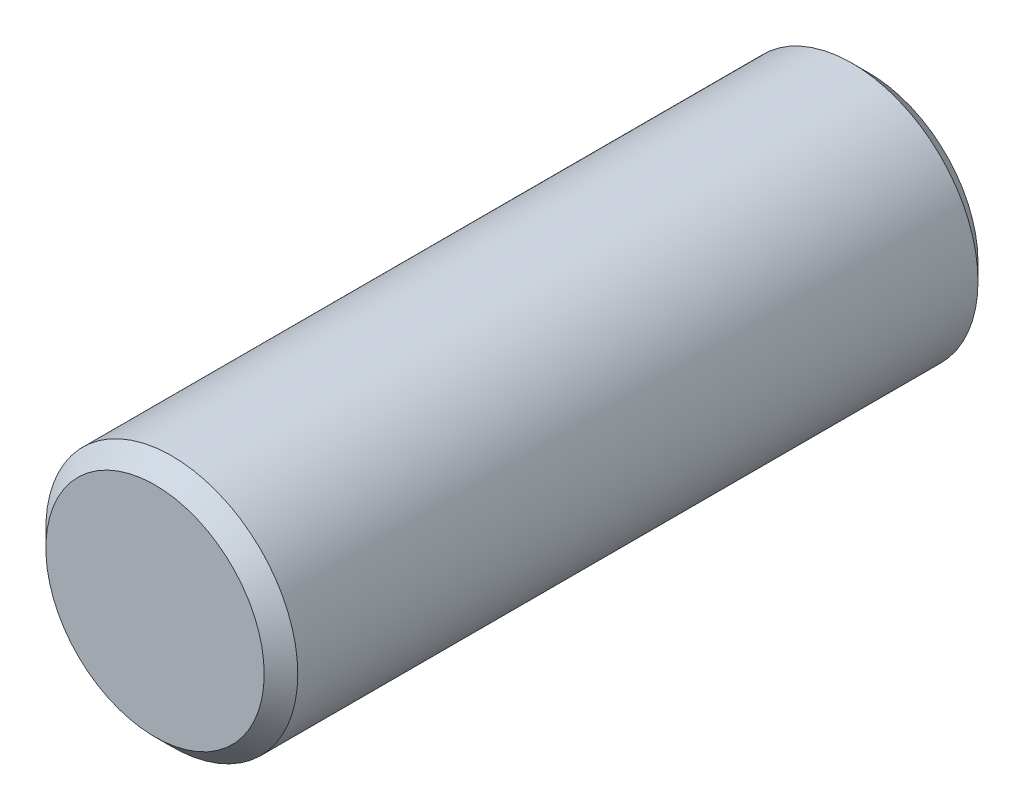
from build123d import *

# Parameters (mm, degrees)
IZIM1_R                     = 15
Y_KSEKLIK_EKSTR_ZYON1_DEPTH = 85
PAH1_SIZE                   = 2


with BuildPart() as part:
    # Çizim1 → Yükseklik-Ekstrüzyon1 (new body)
    with BuildSketch(Plane.XY):
        Circle(IZIM1_R)
    extrude(amount=Y_KSEKLIK_EKSTR_ZYON1_DEPTH)

    # Pah1
    pah1_edges = [part.edges().sort_by_distance(p)[0] for p in [
        (-15, 0, 0),
        (-15, 0, 85),
    ]]
    chamfer(pah1_edges, length=PAH1_SIZE)


solid = part.part
